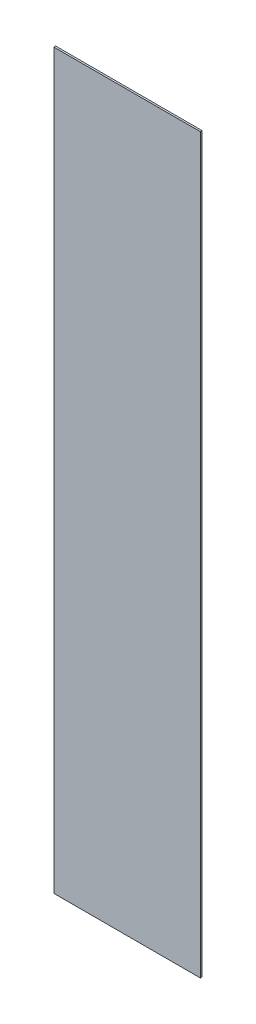
from build123d import *

# Parameters (mm, degrees)
SKETCH1_W           = 50.8
SKETCH1_H           = 254
BOSS_EXTRUDE1_DEPTH = 0.635


with BuildPart() as part:
    # Sketch1 → Boss-Extrude1 (new body)
    with BuildSketch(Plane.XY):
        with Locations((25.4, 127)):
            Rectangle(SKETCH1_W, SKETCH1_H)
    extrude(amount=BOSS_EXTRUDE1_DEPTH)


solid = part.part
